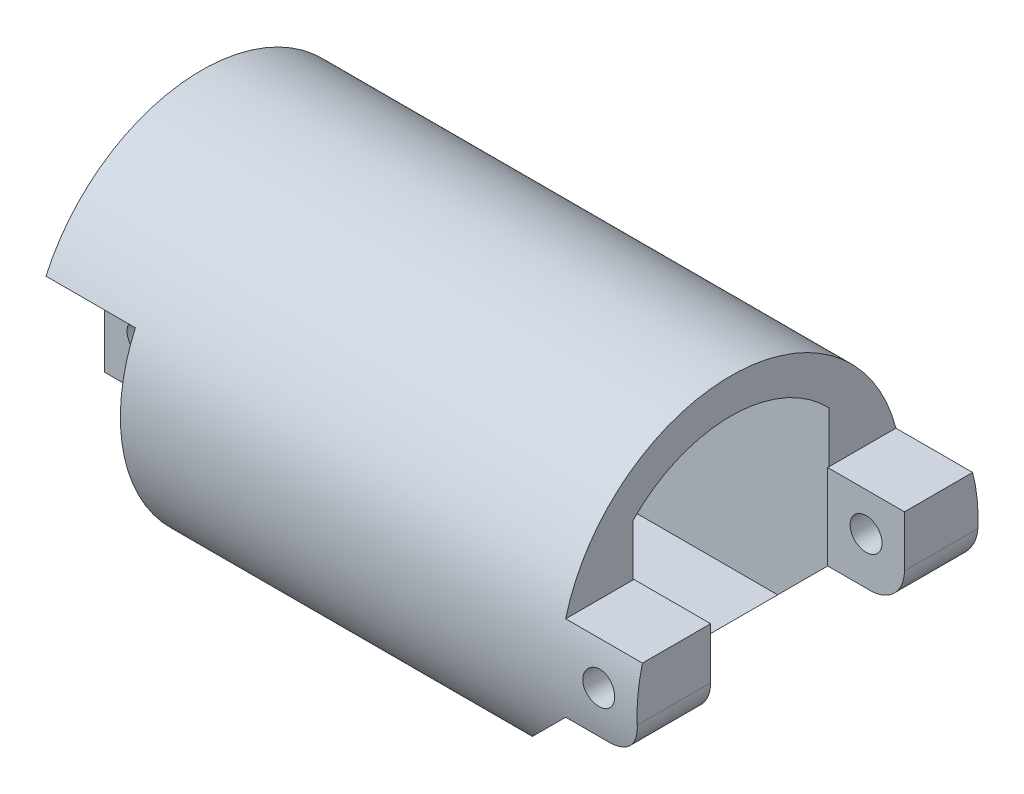
from build123d import *
from build123d.topology import SkipClean

# Parameters (mm, degrees)
SKETCH1_R           = 10
BOSS_EXTRUDE1_DEPTH = 10
SKETCH4_R           = 1.305
CUT_EXTRUDE3_DEPTH  = 25.5
BOSS_EXTRUDE2_START = 4.5
BOSS_EXTRUDE2_DEPTH = 4.5
SKETCH6_R           = 0.935
CUT_EXTRUDE4_DEPTH  = 12.25
SKETCH7_W           = 11.364916732
SKETCH7_H           = 5
BOSS_EXTRUDE3_DEPTH = 4.5
SKETCH8_R           = 0.935
CUT_EXTRUDE5_DEPTH  = 7.25
BOSS_EXTRUDE4_DEPTH = 4.5
CUT_EXTRUDE6_START  = -0.75
CUT_EXTRUDE6_DEPTH  = 0.75
SKETCH12_W          = 5.25
SKETCH12_H          = 4
CUT_EXTRUDE7_DEPTH  = 1.6
CUT_EXTRUDE8_DEPTH  = 15.8
FILLET1_R           = 2
CUT_EXTRUDE9_DEPTH  = 10.8
SKETCH15_W          = 11.364916732
SKETCH15_H          = 6.6
CUT_EXTRUDE10_DEPTH = 1.6
CUT_EXTRUDE11_DEPTH = 15
BOSS_EXTRUDE5_REACH = 35.438
SKETCH17_R          = 10
SKETCH17_R_2        = 1.305
CUT_EXTRUDE12_DEPTH = 14
SCALE1_SCALE        = 0.8


# Read off the part's stored shape, not the designer's step: Cut-Extrude6
with BuildPart() as part:
    # Sketch1 → Boss-Extrude1 (new, symmetric)
    with BuildSketch(Plane(origin=(0, 0, 0), x_dir=(0, 0, -1), z_dir=(1, 0, 0))):
        Circle(SKETCH1_R)
    extrude(amount=BOSS_EXTRUDE1_DEPTH, both=True)

    # Sketch4 → Cut-Extrude3 (cut, symmetric)
    with BuildSketch(Plane(origin=(0, -0.76336978, 0), x_dir=(0, 0, -1), z_dir=(1, 0, 0))):
        with Locations((0, -6.913267104)):
            Circle(SKETCH4_R)
    extrude(amount=CUT_EXTRUDE3_DEPTH, both=True, mode=Mode.SUBTRACT)

    # Sketch5 → Boss-Extrude2 (add)
    with BuildSketch(Plane(origin=(10, 0, 0), x_dir=(0, 0, -1), z_dir=(1, 0, 0)).offset(BOSS_EXTRUDE2_START)):
        with BuildLine():
            Line((-9.682458366, -2.5), (-5.682458366, -2.5))
            Line((-5.682458366, -2.5), (-5.682458366, 2.5))
            Line((-5.682458366, 2.5), (-9.682458366, 2.5))
            ThreePointArc((-9.682458366, 2.5), (-10, 0), (-9.682458366, -2.5))
        make_face()
    boss_extrude2 = extrude(amount=-BOSS_EXTRUDE2_DEPTH)

    # Mirror1: Boss-Extrude2 across plane
    add(boss_extrude2.mirror(Plane.XY))

    # Sketch6 → Cut-Extrude4 (cut, symmetric)
    with SkipClean():  # the faces are left unmerged after this step: merging them gives an invalid solid
        with BuildSketch(Plane.XY):
            with Locations((12.25, 0.25)):
                Circle(SKETCH6_R)
        extrude(amount=CUT_EXTRUDE4_DEPTH, both=True, mode=Mode.SUBTRACT)

    # Sketch7 → Boss-Extrude3 (add)
    with SkipClean():  # the faces are left unmerged after this step: merging them gives an invalid solid
        with BuildSketch(Plane.ZY.offset(10)):
            Rectangle(SKETCH7_W, SKETCH7_H)
        extrude(amount=BOSS_EXTRUDE3_DEPTH)

    # Sketch8 → Cut-Extrude5 (cut, symmetric)
    with SkipClean():  # the faces are left unmerged after this step: merging them gives an invalid solid
        with BuildSketch(Plane.XY):
            with Locations((-12.25, 0.25)):
                Circle(SKETCH8_R)
        extrude(amount=CUT_EXTRUDE5_DEPTH, both=True, mode=Mode.SUBTRACT)

    # Sketch10 → Boss-Extrude4 (add)
    with SkipClean():  # the faces are left unmerged after this step: merging them gives an invalid solid
        with BuildSketch(Plane.ZY.offset(10)):
            with BuildLine():
                Line((9.682458366, 2.5), (-9.682458366, 2.5))
                ThreePointArc((-9.682458366, 2.5), (0, 10), (9.682458366, 2.5))
            make_face()
        extrude(amount=BOSS_EXTRUDE4_DEPTH)

    # Cut-Extrude6 outline → Cut-Extrude6 (cut)
    with SkipClean():  # the faces are left unmerged after this step: merging them gives an invalid solid
        with BuildSketch(Plane.ZY.offset(10).offset(CUT_EXTRUDE6_START)):
            with BuildLine():
                ThreePointArc((-9.682458366, 2.5), (-9.369942303, -3.493448331), (-5.682458366, -8.228588392))
                Line((-5.682458366, -8.228588392), (-5.682458366, 2.5))
                Line((-5.682458366, 2.5), (-9.682458366, 2.5))
            make_face()
            with BuildLine():
                Line((5.682458366, 2.5), (5.682458366, -8.228588392))
                ThreePointArc((5.682458366, -8.228588392), (9.369942303, -3.493448331), (9.682458366, 2.5))
                Line((9.682458366, 2.5), (5.682458366, 2.5))
            make_face()
        extrude(amount=CUT_EXTRUDE6_DEPTH, mode=Mode.SUBTRACT)

    # Sketch12 → Cut-Extrude7 (cut)
    with SkipClean():  # the faces are left unmerged after this step: merging them gives an invalid solid
        with BuildSketch(Plane.XZ.offset(-2.5)):
            with Locations((-11.875, -7.682458366)):
                Rectangle(SKETCH12_W, SKETCH12_H)
            with Locations((-11.875, 7.682458366)):
                Rectangle(SKETCH12_W, SKETCH12_H)
        extrude(amount=-CUT_EXTRUDE7_DEPTH, mode=Mode.SUBTRACT)

    # Sketch13 → Cut-Extrude8 (cut, symmetric)
    with SkipClean():  # the faces are left unmerged after this step: merging them gives an invalid solid
        with BuildSketch(Plane.XY):
            Polygon((-10, -8.228588392), (-10, -2.5), (-2.5, -10), (-10, -10), align=None)
        extrude(amount=CUT_EXTRUDE8_DEPTH, both=True, mode=Mode.SUBTRACT)

    # Fillet1
    fillet1_edges = [part.edges().sort_by_distance(p)[0] for p in [
        (14.5, -2.5, 7.682458366),
        (14.5, -2.5, -7.682458366),
    ]]
    fillet(fillet1_edges, radius=FILLET1_R)

    # Sketch14 → Cut-Extrude9 (cut, symmetric)
    with SkipClean():  # the faces are left unmerged after this step: merging them gives an invalid solid
        with BuildSketch(Plane.XY):
            Polygon((10, -10), (10, -2.5), (2.5, -10), align=None)
        extrude(amount=CUT_EXTRUDE9_DEPTH, both=True, mode=Mode.SUBTRACT)

    # Sketch15 → Cut-Extrude10 (cut)
    with SkipClean():  # the faces are left unmerged after this step: merging them gives an invalid solid
        with BuildSketch(Plane(origin=(10, 0, 0), x_dir=(0, 0, -1), z_dir=(1, 0, 0))):
            with Locations((0, -0.8)):
                Rectangle(SKETCH15_W, SKETCH15_H)
        extrude(amount=-CUT_EXTRUDE10_DEPTH, mode=Mode.SUBTRACT)

    # Sketch16 → Cut-Extrude11 (cut)
    with SkipClean():  # the faces are left unmerged after this step: merging them gives an invalid solid
        with BuildSketch(Plane(origin=(10, 0, 0), x_dir=(0, 0, -1), z_dir=(1, 0, 0))):
            with BuildLine():
                Line((-5.75, 5.5), (-5.75, -5.5))
                Line((-5.75, -5.5), (5.75, -5.5))
                Line((5.75, -5.5), (5.75, 5.5))
                ThreePointArc((5.75, 5.5), (0, 7.956915231), (-5.75, 5.5))
            make_face()
        extrude(amount=-CUT_EXTRUDE11_DEPTH, mode=Mode.SUBTRACT)


with BuildPart() as body_2:
    # Split1: the piece on the far side of the plane
    add(part.part)
    split(bisect_by=Plane(origin=(0, 0, 0), x_dir=(0, 0, 1), z_dir=(1, 0, 0)), keep=Keep.BOTTOM)


with BuildPart() as part_1:
    add(part.part)

    # Split1
    split(bisect_by=Plane(origin=(0, 0, 0), x_dir=(0, 0, 1), z_dir=(1, 0, 0)), keep=Keep.TOP)


with BuildPart() as part_2:
    # Body-Move/Copy1: moved
    add(part_1.part.moved(Location((15.8, 0, 0))))


    # Sketch17 → Boss-Extrude5 (add, up to next)
    with BuildSketch(Plane.ZY.offset(-15.8), mode=Mode.PRIVATE) as boss_extrude5_sk1:
        with Locations(Location((0, 0, 0), (0, 0, 357.134016017))):
            Circle(SKETCH17_R)
        with Locations(Location((0, -7.676636884, 0), (0, 0, 180))):
            Circle(SKETCH17_R_2, mode=Mode.SUBTRACT)
        with BuildLine():
            Line((-5.75, -5.5), (5.75, -5.5))
            Line((5.75, -5.5), (5.75, 5.5))
            ThreePointArc((5.75, 5.5), (0, 7.956915231), (-5.75, 5.5))
            Line((-5.75, 5.5), (-5.75, -5.5))
        make_face(mode=Mode.SUBTRACT)
    boss_extrude5_tool1 = extrude(boss_extrude5_sk1.sketch, amount=BOSS_EXTRUDE5_REACH, mode=Mode.PRIVATE) - body_2.part
    add(boss_extrude5_tool1.solids().sort_by_distance((15.8, 0.485858, -9.705003))[0])


with BuildPart() as body_2_1:
    # Body-Move/Copy2: moved
    add(body_2.part.moved(Location((9.26, 0, 0))))

    # Combine4: union part
    add(part_2.part)

    # Sketch18 → Cut-Extrude12 (cut)
    with SkipClean():  # the faces are left unmerged after this step: merging them gives an invalid solid
        with BuildSketch(Plane.ZY.offset(5.24)):
            with BuildLine():
                Line((-5.75, 5.5), (-5.75, 4.1))
                Line((-5.75, 4.1), (5.75, 4.1))
                Line((5.75, 4.1), (5.75, 5.5))
                ThreePointArc((5.75, 5.5), (0, 7.956915231), (-5.75, 5.5))
            make_face()
        extrude(amount=-CUT_EXTRUDE12_DEPTH, mode=Mode.SUBTRACT)


with BuildPart() as body_2_2:
    # Scale1: scaled about (10.157754057, 0.26372377, 1.86e-07)
    add(body_2_1.part.scale(SCALE1_SCALE).moved(Location((2.031550811, 0.052744754, 3.7e-08))))


solid = body_2_2.part
